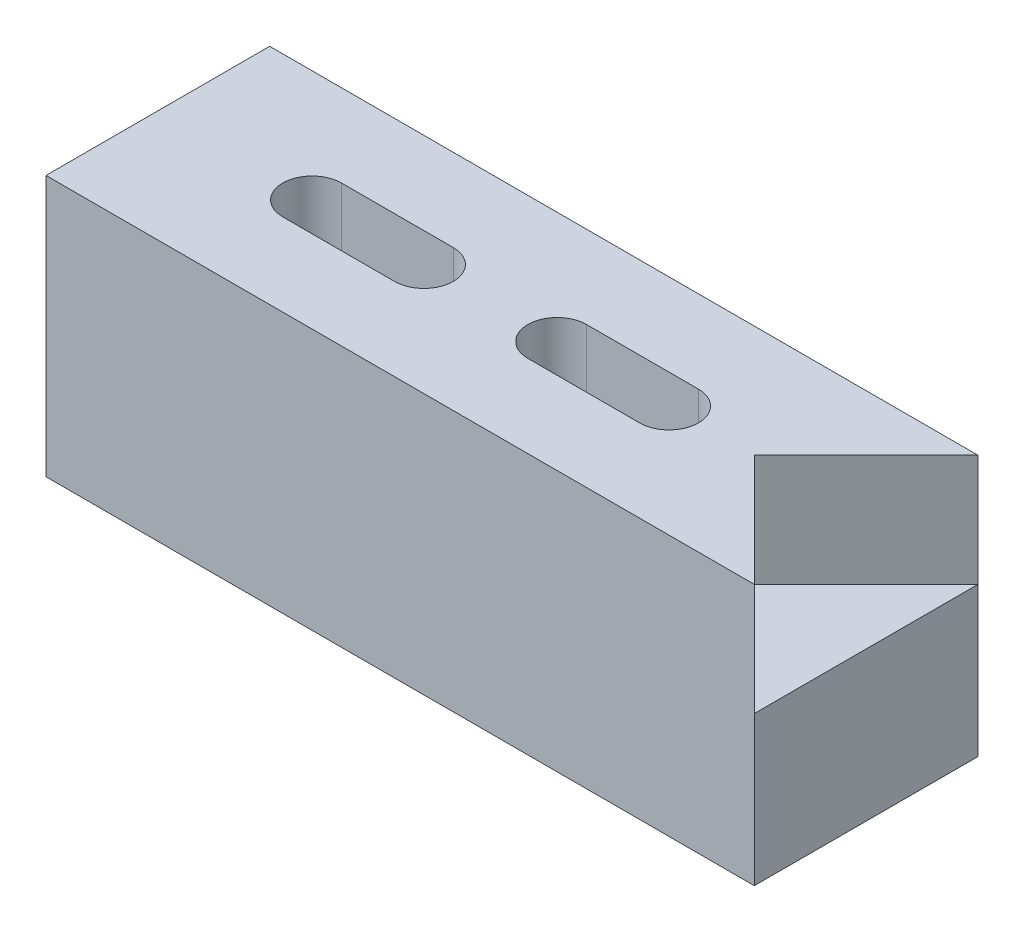
from build123d import *

# Parameters (mm, degrees)
SKETCH1_W           = 48.26
SKETCH1_H           = 17.78
BOSS_EXTRUDE1_DEPTH = 15.24
CUT_EXTRUDE1_DEPTH  = 7.62
CUT_EXTRUDE2_DEPTH  = 54.641528688


with BuildPart() as part:
    # Sketch1 → Boss-Extrude1 (new body)
    with BuildSketch(Plane.XY):
        with Locations((24.13, 8.89)):
            Rectangle(SKETCH1_W, SKETCH1_H)
    extrude(amount=-BOSS_EXTRUDE1_DEPTH)

    # Sketch3 → Cut-Extrude1 (cut)
    with BuildSketch(Plane(origin=(0, 17.78, 0), x_dir=(1, 0, 0), z_dir=(0, 1, 0))):
        Polygon((48.26, 15.24), (40.64, 7.62), (48.26, 0), align=None)
    extrude(amount=-CUT_EXTRUDE1_DEPTH, mode=Mode.SUBTRACT)

    # Sketch4 → Cut-Extrude2 (cut, through all)
    with BuildSketch(Plane(origin=(0, 17.78, 0), x_dir=(1, 0, 0), z_dir=(0, 1, 0))):
        with BuildLine():
            Line((34.83, 5.62), (27.21, 5.62))
            ThreePointArc((27.21, 5.62), (25.21, 7.62), (27.21, 9.62))
            Line((27.21, 9.62), (34.83, 9.62))
            ThreePointArc((34.83, 9.62), (36.83, 7.62), (34.83, 5.62))
        make_face()
        with BuildLine():
            Line((18.13, 5.62), (10.51, 5.62))
            ThreePointArc((10.51, 5.62), (8.51, 7.62), (10.51, 9.62))
            Line((10.51, 9.62), (18.13, 9.62))
            ThreePointArc((18.13, 9.62), (20.13, 7.62), (18.13, 5.62))
        make_face()
    extrude(amount=-CUT_EXTRUDE2_DEPTH, mode=Mode.SUBTRACT)


solid = part.part
